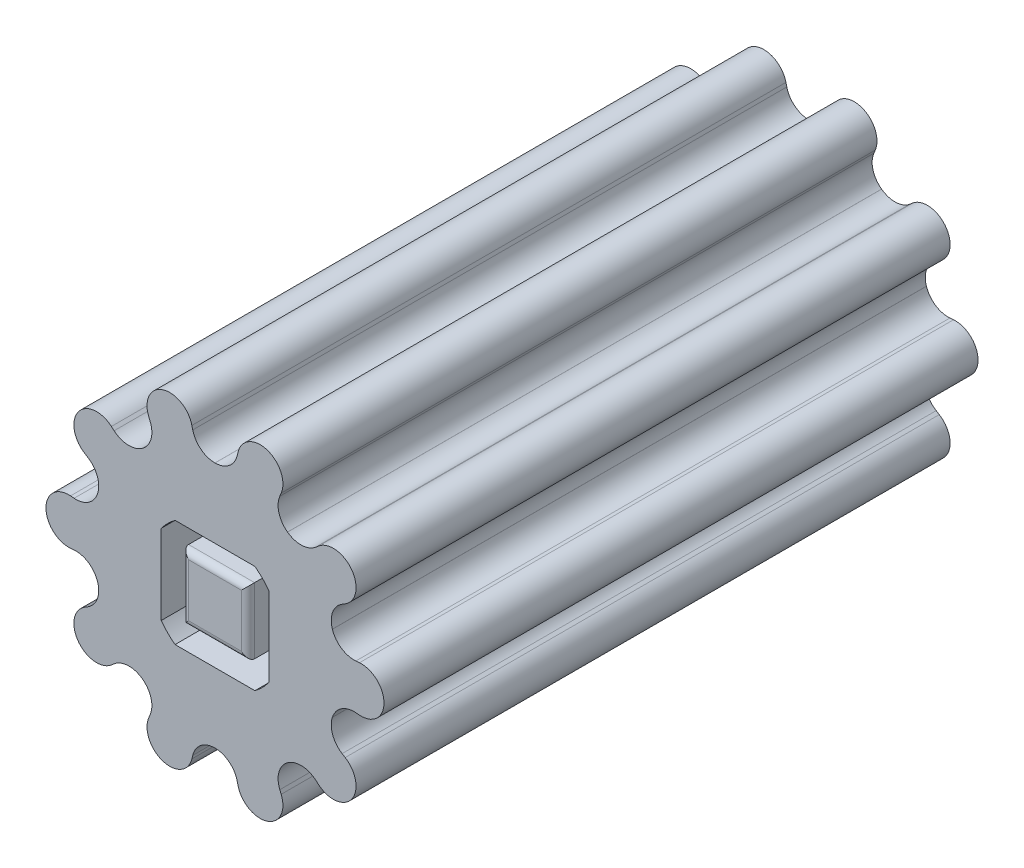
from build123d import *

# Parameters (mm, degrees)
BOSS_EXTRUDE1_DEPTH = 22.5
SKETCH2_W           = 5
SKETCH2_H           = 5
CUT_EXTRUDE1_DEPTH  = 10
FILLET1_R           = 0.5


with BuildPart() as part:
    # Sketch1 → Boss-Extrude1 (new, symmetric)
    with BuildSketch(Plane.XY):
        with BuildLine():
            ThreePointArc((5.016365766, 9.879396464), (3.956395108, 12.17653209), (1.748638388, 10.941145451))
            Line((1.748638388, 10.941145451), (1.684535448, 10.674959833))
            ThreePointArc((1.684535448, 10.674959833), (1.073014619, 9.720899487), (0.002210133, 9.349999739))
            ThreePointArc((0.002210133, 9.349999739), (0, 9.35), (-0.002210133, 9.349999739))
            ThreePointArc((-0.002210133, 9.349999739), (-1.073014619, 9.720899487), (-1.684535448, 10.674959833))
            Line((-1.684535448, 10.674959833), (-1.748638388, 10.941145451))
            ThreePointArc((-1.748638388, 10.941145451), (-3.956395108, 12.17653209), (-5.016365766, 9.879396464))
            Line((-5.016365766, 9.879396464), (-4.911766153, 9.626369013))
            ThreePointArc((-4.911766153, 9.626369013), (-4.845714296, 8.495075054), (-5.49400392, 7.56560777))
            ThreePointArc((-5.49400392, 7.56560777), (-5.495792109, 7.564308897), (-5.497579991, 7.563009602))
            ThreePointArc((-5.497579991, 7.563009602), (-6.581888419, 7.233670717), (-7.637401764, 7.646078826))
            Line((-7.637401764, 7.646078826), (-7.845722113, 7.823748752))
            ThreePointArc((-7.845722113, 7.823748752), (-10.357976865, 7.525510697), (-9.865288698, 5.044053816))
            Line((-9.865288698, 5.044053816), (-9.631940029, 4.900832418))
            ThreePointArc((-9.631940029, 4.900832418), (-8.913545049, 4.024420687), (-8.89169521, 2.891410778))
            ThreePointArc((-8.89169521, 2.891410778), (-8.892378427, 2.889308897), (-8.893061148, 2.887206855))
            ThreePointArc((-8.893061148, 2.887206855), (-9.576704554, 1.983425597), (-10.673040192, 1.696655588))
            Line((-10.673040192, 1.696655588), (-10.946006656, 1.717945949))
            ThreePointArc((-10.946006656, 1.717945949), (-12.803163515, 0), (-10.946006656, -1.717945949))
            Line((-10.946006656, -1.717945949), (-10.673040192, -1.696655588))
            ThreePointArc((-10.673040192, -1.696655588), (-9.576704554, -1.983425597), (-8.893061148, -2.887206855))
            ThreePointArc((-8.893061148, -2.887206855), (-8.892378427, -2.889308897), (-8.89169521, -2.891410778))
            ThreePointArc((-8.89169521, -2.891410778), (-8.913545049, -4.024420687), (-9.631940029, -4.900832418))
            Line((-9.631940029, -4.900832418), (-9.865288698, -5.044053816))
            ThreePointArc((-9.865288698, -5.044053816), (-10.357976865, -7.525510697), (-7.845722113, -7.823748752))
            Line((-7.845722113, -7.823748752), (-7.637401764, -7.646078826))
            ThreePointArc((-7.637401764, -7.646078826), (-6.581888419, -7.233670717), (-5.497579991, -7.563009602))
            ThreePointArc((-5.497579991, -7.563009602), (-5.495792109, -7.564308897), (-5.49400392, -7.56560777))
            ThreePointArc((-5.49400392, -7.56560777), (-4.845714296, -8.495075054), (-4.911766153, -9.626369013))
            Line((-4.911766153, -9.626369013), (-5.016365766, -9.879396464))
            ThreePointArc((-5.016365766, -9.879396464), (-3.956395108, -12.17653209), (-1.748638388, -10.941145451))
            Line((-1.748638388, -10.941145451), (-1.684535448, -10.674959833))
            ThreePointArc((-1.684535448, -10.674959833), (-1.073014619, -9.720899487), (-0.002210133, -9.349999739))
            ThreePointArc((-0.002210133, -9.349999739), (0, -9.35), (0.002210133, -9.349999739))
            ThreePointArc((0.002210133, -9.349999739), (1.073014619, -9.720899487), (1.684535448, -10.674959833))
            Line((1.684535448, -10.674959833), (1.748638388, -10.941145451))
            ThreePointArc((1.748638388, -10.941145451), (3.956395108, -12.17653209), (5.016365766, -9.879396464))
            Line((5.016365766, -9.879396464), (4.911766153, -9.626369013))
            ThreePointArc((4.911766153, -9.626369013), (4.845714296, -8.495075054), (5.49400392, -7.56560777))
            ThreePointArc((5.49400392, -7.56560777), (5.495792109, -7.564308897), (5.497579991, -7.563009602))
            ThreePointArc((5.497579991, -7.563009602), (6.581888419, -7.233670717), (7.637401764, -7.646078826))
            Line((7.637401764, -7.646078826), (7.845722113, -7.823748752))
            ThreePointArc((7.845722113, -7.823748752), (10.357976865, -7.525510697), (9.865288698, -5.044053816))
            Line((9.865288698, -5.044053816), (9.631940029, -4.900832418))
            ThreePointArc((9.631940029, -4.900832418), (8.913545049, -4.024420687), (8.89169521, -2.891410778))
            ThreePointArc((8.89169521, -2.891410778), (8.892378427, -2.889308897), (8.893061148, -2.887206855))
            ThreePointArc((8.893061148, -2.887206855), (9.576704554, -1.983425597), (10.673040192, -1.696655588))
            Line((10.673040192, -1.696655588), (10.946006656, -1.717945949))
            ThreePointArc((10.946006656, -1.717945949), (12.803163515, 0), (10.946006656, 1.717945949))
            Line((10.946006656, 1.717945949), (10.673040192, 1.696655588))
            ThreePointArc((10.673040192, 1.696655588), (9.576704554, 1.983425597), (8.893061148, 2.887206855))
            ThreePointArc((8.893061148, 2.887206855), (8.892378427, 2.889308897), (8.89169521, 2.891410778))
            ThreePointArc((8.89169521, 2.891410778), (8.913545049, 4.024420687), (9.631940029, 4.900832418))
            Line((9.631940029, 4.900832418), (9.865288698, 5.044053816))
            ThreePointArc((9.865288698, 5.044053816), (10.357976865, 7.525510697), (7.845722113, 7.823748752))
            Line((7.845722113, 7.823748752), (7.637401764, 7.646078826))
            ThreePointArc((7.637401764, 7.646078826), (6.581888419, 7.233670717), (5.497579991, 7.563009602))
            ThreePointArc((5.497579991, 7.563009602), (5.495792109, 7.564308897), (5.49400392, 7.56560777))
            ThreePointArc((5.49400392, 7.56560777), (4.845714296, 8.495075054), (4.911766153, 9.626369013))
            Line((4.911766153, 9.626369013), (5.016365766, 9.879396464))
        make_face()
    extrude(amount=BOSS_EXTRUDE1_DEPTH, both=True)

    # Sketch2 → Cut-Extrude1 (cut)
    with BuildSketch(Plane.XY.offset(22.5)):
        with BuildLine():
            Line((-3.024896692, -4.075), (3.024896692, -4.075))
            ThreePointArc((3.024896692, -4.075), (3.588566915, -3.588566915), (4.075, -3.024896692))
            Line((4.075, -3.024896692), (4.075, 3.024896692))
            ThreePointArc((4.075, 3.024896692), (3.588566915, 3.588566915), (3.024896692, 4.075))
            Line((3.024896692, 4.075), (-3.024896692, 4.075))
            ThreePointArc((-3.024896692, 4.075), (-3.588566915, 3.588566915), (-4.075, 3.024896692))
            Line((-4.075, 3.024896692), (-4.075, -3.024896692))
            ThreePointArc((-4.075, -3.024896692), (-3.588566915, -3.588566915), (-3.024896692, -4.075))
        make_face()
        Rectangle(SKETCH2_W, SKETCH2_H, mode=Mode.SUBTRACT)
    cut_extrude1 = extrude(amount=-CUT_EXTRUDE1_DEPTH, mode=Mode.SUBTRACT)

    # Mirror1: Cut-Extrude1 across plane
    add(cut_extrude1.mirror(Plane.XY), mode=Mode.SUBTRACT)

    # Fillet1
    fillet1_edges = [part.edges().sort_by_distance(p)[0] for p in [
        (-2.5, 0, 22.5),
        (0, 2.5, 22.5),
        (2.5, 0, 22.5),
        (0, -2.5, 22.5),
        (-2.5, 0, -22.5),
        (0, -2.5, -22.5),
        (2.5, 0, -22.5),
        (0, 2.5, -22.5),
        (-2.5, -2.5, -17.5),
    ]]
    fillet(fillet1_edges, radius=FILLET1_R)


solid = part.part
